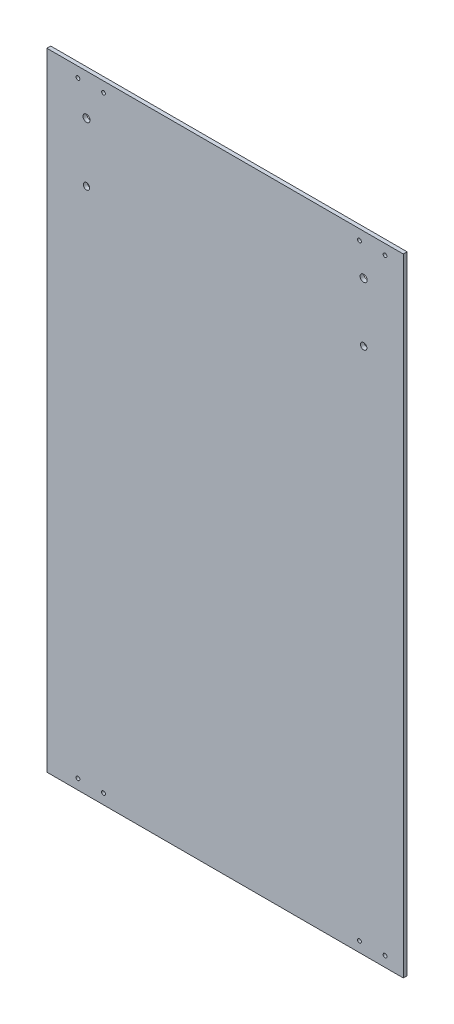
from build123d import *

# Parameters (mm, degrees)
SKETCH_1_W               = 278.56
SKETCH_1_H               = 490
SKETCH_1_R               = 1.5
EXTRUDE_1_DEPTH          = 3
SKETCH_2_R               = 2.5
CUT_EXTRUDE_1_DEPTH      = 10
CUT_EXTRUDE_2_DEPTH      = 282.838461534
CUT_EXTRUDE_2_DEPTH_BACK = 282.838461534
SKETCH_3_R               = 2.75


with BuildPart() as part:
    # 草图1 → 凸台-拉伸1 (new body)
    with BuildSketch(Plane.XY):
        Rectangle(SKETCH_1_W, SKETCH_1_H)
        with Locations((104.999070074, 237)):
            Circle(SKETCH_1_R, mode=Mode.SUBTRACT)
        with Locations((124.999070074, 237)):
            Circle(SKETCH_1_R, mode=Mode.SUBTRACT)
        with Locations((-95.000929926, 237)):
            Circle(SKETCH_1_R, mode=Mode.SUBTRACT)
        with Locations((-115.000929926, 237)):
            Circle(SKETCH_1_R, mode=Mode.SUBTRACT)
        with Locations((124.999070074, -237)):
            Circle(SKETCH_1_R, mode=Mode.SUBTRACT)
        with Locations((104.999070074, -237)):
            Circle(SKETCH_1_R, mode=Mode.SUBTRACT)
        with Locations((-95.000929926, -237)):
            Circle(SKETCH_1_R, mode=Mode.SUBTRACT)
        with Locations((-115.000929926, -237)):
            Circle(SKETCH_1_R, mode=Mode.SUBTRACT)
    extrude(amount=EXTRUDE_1_DEPTH)

    # 草图2 → 切除-拉伸1 (cut)
    with BuildSketch(Plane(origin=(0, 0, 0), x_dir=(-1, 0, 0), z_dir=(0, 0, -1))):
        with Locations((-108.275469408, 167.088125342)):
            Circle(SKETCH_2_R)
        with Locations((108.284530592, 167.088125342)):
            Circle(SKETCH_2_R)
    extrude(amount=-CUT_EXTRUDE_1_DEPTH, mode=Mode.SUBTRACT)

    # 草图3 → 切除-拉伸2 (cut, two sides: drawn at the far end of the back side and taken through both)
    with BuildSketch(Plane(origin=(0, 0, 0), x_dir=(-1, 0, 0), z_dir=(0, 0, -1)).offset(-CUT_EXTRUDE_2_DEPTH_BACK)):
        with Locations((108.284530592, 213.088125342)):
            Circle(SKETCH_3_R)
        with Locations((-108.275469408, 213.088125342)):
            Circle(SKETCH_3_R)
    extrude(amount=CUT_EXTRUDE_2_DEPTH + CUT_EXTRUDE_2_DEPTH_BACK, mode=Mode.SUBTRACT)


solid = part.part
